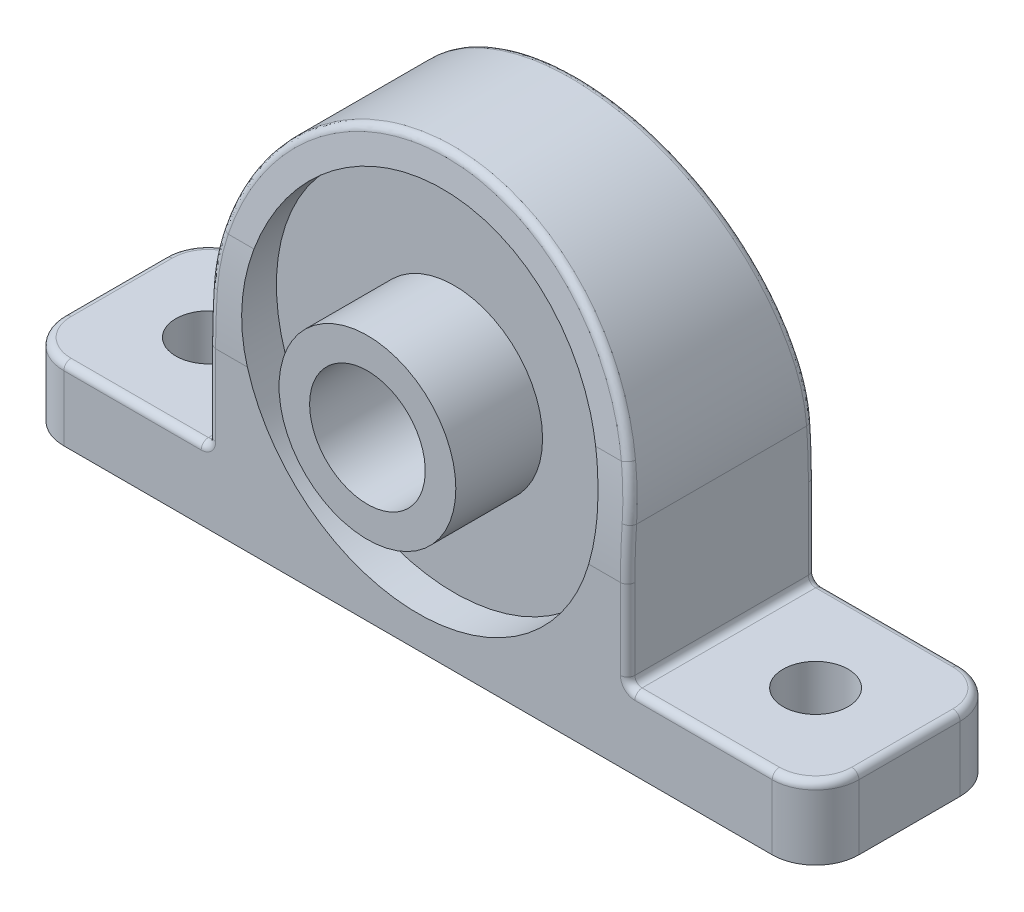
from build123d import *

# Parameters (mm, degrees)
ESQUISSE1_R             = 4
BOSS_EXTRU_1_DEPTH      = 13
ESQUISSE2_R             = 12.296826447
ENL_V_MAT_EXTRU_1_DEPTH = 2.5
ENL_V_START             = -2.5
ESQUISSE3_R             = 12.296826447
ENL_V_MAT_EXTRU_2_DEPTH = 2.5
ESQUISSE4_R             = 2.25
ENL_V_MAT_EXTRU_3_DEPTH = 64.521649853
ENL_V_MAT_EXTRU_4_DEPTH = 64.521649853
ESQUISSE6_R             = 6.114565484
ESQUISSE6_R_2           = 4
BOSS_EXTRU_2_DEPTH      = 6
BOSS_EXTRU_3_START      = 0.5
ESQUISSE7_R             = 6.114565484
ESQUISSE7_R_2           = 4
BOSS_EXTRU_3_DEPTH      = 0.5
CONG_1_R                = 50
CONG_2_R                = 3
CONG_3_R                = 0.5


with BuildPart() as part:
    # Esquisse1 → Boss.-Extru.1 (new body)
    with BuildSketch(Plane.XY):
        with BuildLine():
            Line((13, 14.5), (13, 5))
            Line((13, 5), (0, 5))
            Line((0, 5), (0, 0))
            Line((0, 0), (55, 0))
            Line((55, 0), (55, 5))
            Line((55, 5), (42, 5))
            Line((42, 5), (42, 14.5))
            ThreePointArc((42, 14.5), (27.5, 29), (13, 14.5))
        make_face()
        with Locations(Location((27.5, 14.5, 0), (0, 0, 180))):
            Circle(ESQUISSE1_R, mode=Mode.SUBTRACT)
    extrude(amount=BOSS_EXTRU_1_DEPTH)

    # Esquisse2 → Enlèv. mat.-Extru.1 (cut)
    with BuildSketch(Plane.XY.offset(13)):
        with Locations((27.5, 14.5)):
            Circle(ESQUISSE2_R)
    extrude(amount=-ENL_V_MAT_EXTRU_1_DEPTH, mode=Mode.SUBTRACT)

    # Esquisse3 → Enlèv. mat.-Extru.2 (cut)
    with BuildSketch(Plane(origin=(0, 0, 0), x_dir=(-1, 0, 0), z_dir=(0, 0, -1)).offset(ENL_V_START)):
        with Locations(Location((-27.5, 14.5, 0), (0, 0, 180))):
            Circle(ESQUISSE3_R)
    extrude(amount=ENL_V_MAT_EXTRU_2_DEPTH, mode=Mode.SUBTRACT)

    # Esquisse4 → Enlèv. mat.-Extru.3 (cut, through all)
    with BuildSketch(Plane.XZ):
        with Locations(Location((6.5, 6.5, 0), (0, 0, 270))):
            Circle(ESQUISSE4_R)
        with Locations(Location((48.5, 6.5, 0), (0, 0, 270))):
            Circle(ESQUISSE4_R)
    extrude(amount=-ENL_V_MAT_EXTRU_3_DEPTH, mode=Mode.SUBTRACT)

    # Esquisse5 → Enlèv. mat.-Extru.4 (cut, through all)
    with BuildSketch(Plane.ZY):
        Polygon((0, 14.5), (2, 29), (11, 29), (13, 14.5), (15.797282188, 14.5), (15.797282188, 29.96852593), (-2.682605776, 29.96852593), (-2.682605776, 14.5), align=None)
    extrude(amount=-ENL_V_MAT_EXTRU_4_DEPTH, mode=Mode.SUBTRACT)

    # Esquisse6 → Boss.-Extru.2 (add)
    with BuildSketch(Plane.XY.offset(10.5)):
        with Locations((27.5, 14.5)):
            Circle(ESQUISSE6_R)
        with Locations(Location((27.5, 14.5, 0), (0, 0, 180))):
            Circle(ESQUISSE6_R_2, mode=Mode.SUBTRACT)
    extrude(amount=BOSS_EXTRU_2_DEPTH)

    # Esquisse7 → Boss.-Extru.3 (add)
    with BuildSketch(Plane(origin=(0, 0, 2.5), x_dir=(-1, 0, 0), z_dir=(0, 0, -1)).offset(BOSS_EXTRU_3_START)):
        with Locations(Location((-27.5, 14.5, 0), (0, 0, 180))):
            Circle(ESQUISSE7_R)
        with Locations((-27.5, 14.5)):
            Circle(ESQUISSE7_R_2, mode=Mode.SUBTRACT)
    extrude(amount=-BOSS_EXTRU_3_DEPTH)

    # Congé1
    # the kernel refuses this fillet: 50 mm, written as the material it takes off along each edge
    with BuildSketch(Plane(origin=(31.216753428, 14.5, 13), x_dir=(0, -1, 0), z_dir=(1, 0, 0))) as cong_1_piece_1_section:
        with BuildLine():
            CenterArc((CONG_1_R * 0.0686405841522, CONG_1_R), CONG_1_R, 262.146686698, 7.853313302)
            Line((-CONG_1_R * 0.0679968129848, CONG_1_R * 0.00937887075653), (0, 0))
            Line((0, 0), (CONG_1_R * 0.0686405841522, 0))
        make_face()
    cong_1_piece_1 = extrude(amount=19.363319591, mode=Mode.PRIVATE)
    cong_1_piece_1 = cong_1_piece_1 - Plane(origin=(27.5, 14.5, 12.906005867), x_dir=(1, 0, 0), z_dir=(0, 0, -1)) * Cylinder(6.114565484, 53, mode=Mode.PRIVATE)
    add(cong_1_piece_1, mode=Mode.SUBTRACT)
    with BuildSketch(Plane(origin=(4.419926981, 14.5, 13), x_dir=(0, -1, 0), z_dir=(1, 0, 0))) as cong_1_piece_2_section:
        with BuildLine():
            CenterArc((CONG_1_R * 0.0686405841522, CONG_1_R), CONG_1_R, 262.146686698, 7.853313302)
            Line((-CONG_1_R * 0.0679968129848, CONG_1_R * 0.00937887075653), (0, 0))
            Line((0, 0), (CONG_1_R * 0.0686405841522, 0))
        make_face()
    cong_1_piece_2 = extrude(amount=19.363319591, mode=Mode.PRIVATE)
    cong_1_piece_2 = cong_1_piece_2 - Plane(origin=(27.5, 14.5, 12.983190694), x_dir=(1, 0, 0), z_dir=(0, 0, -1)) * Cylinder(6.114565484, 53, mode=Mode.PRIVATE)
    add(cong_1_piece_2, mode=Mode.SUBTRACT)
    with BuildSketch(Plane(origin=(31.216753428, 14.5, 0), x_dir=(0, -1, 0), z_dir=(1, 0, 0)), Plane(origin=(4.419926981, 14.5, 0), x_dir=(0, -1, 0), z_dir=(1, 0, 0))) as cong_1_piece_3:
        with BuildLine():
            CenterArc((CONG_1_R * 0.0686405841522, -CONG_1_R), CONG_1_R, 90, 7.853313302)
            Line((-CONG_1_R * 0.0679968129848, -CONG_1_R * 0.00937887075653), (0, 0))
            Line((0, 0), (CONG_1_R * 0.0686405841522, 0))
        make_face()
    extrude(amount=19.363319591, mode=Mode.SUBTRACT)

    # Congé2
    cong_2_edges = [part.edges().sort_by_distance(p)[0] for p in [
        (55, 2.5, 0),
        (0, 2.5, 13),
        (55, 2.5, 13),
        (0, 2.5, 0),
    ]]
    fillet(cong_2_edges, radius=CONG_2_R)

    # Congé3
    cong_3_edges = [part.edges().sort_by_distance(p)[0] for p in [
        (36.490843101, 25.876059965, 11.430888281),
        (36.490843101, 25.876059965, 1.569111719),
        (13.101744689, 16.214713972, 0.265595061),
        (41.898255311, 16.214713972, 0.265595061),
        (13.101744689, 16.214713972, 12.734404939),
        (41.898255311, 16.214713972, 12.734404939),
        (42, 12.784998117, 0.029490525),
        (42, 12.784998117, 12.970509475),
        (13, 8.033985396, 0),
        (13, 12.784998117, 0.029490525),
        (13, 12.784998117, 12.970509475),
        (55, 5, 6.5),
        (47, 5, 0),
        (47, 5, 13),
        (54.121320344, 5, 12.121320344),
        (54.121320344, 5, 0.878679656),
        (42, 8.033985396, 13),
        (13, 5, 6.5),
        (0, 5, 6.5),
        (0.878679656, 5, 0.878679656),
        (0.878679656, 5, 12.121320344),
        (42, 5, 6.5),
        (8, 5, 13),
        (8, 5, 0),
        (42, 8.033985396, 0),
        (13, 8.033985396, 13),
    ]]
    fillet(cong_3_edges, radius=CONG_3_R)


solid = part.part
